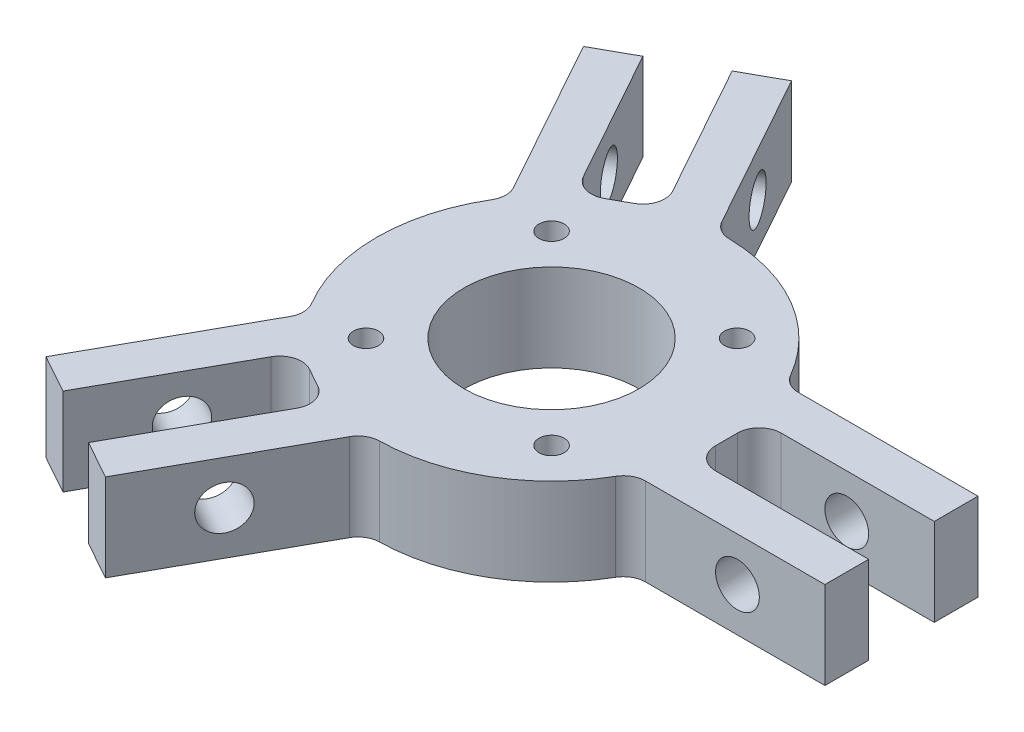
from build123d import *
from OCP.BRepAlgoAPI import BRepAlgoAPI_Cut
from OCP.TopTools import TopTools_ListOfShape

# Parameters (mm, degrees)
SKETCH1_R            = 12.7
SKETCH1_R_2          = 1.8288
BOSS_EXTRUDE1_DEPTH  = 6.35
SKETCH4_W            = 3.175
SKETCH4_H            = 6.35
SKETCH4_AT_POINT_2_W = 3.175
SKETCH4_AT_POINT_2_H = 6.35
SKETCH4_AT_POINT_3_W = 3.175
SKETCH4_AT_POINT_3_H = 6.35
SKETCH4_AT_POINT_4_W = 3.175
SKETCH4_AT_POINT_4_H = 6.35
SKETCH4_AT_POINT_5_W = 3.175
SKETCH4_AT_POINT_5_H = 6.35
SKETCH4_AT_POINT_6_W = 3.175
SKETCH4_AT_POINT_6_H = 6.35
FILLET1_R            = 3.175


with BuildPart() as part:
    # Sketch1 → Boss-Extrude1 (new, symmetric)
    with BuildSketch(Plane(origin=(0, 0, 0), x_dir=(1, 0, 0), z_dir=(0, 1, 0))):
        with BuildLine():
            Line((25.4, 4.7625), (25.4, -4.7625))
            Line((25.4, -4.7625), (50.8, -4.7625))
            Line((50.8, -4.7625), (50.8, -11.1125))
            Line((50.8, -11.1125), (22.84014763, -11.1125))
            ThreePointArc((22.84014763, -11.1125), (12.881044339, -21.891521115), (-1.378083513, -25.362588311))
            Line((-1.378083513, -25.362588311), (-14.956588173, -49.8038967))
            Line((-14.956588173, -49.8038967), (-20.507486876, -46.720064087))
            Line((-20.507486876, -46.720064087), (-8.172156424, -24.516469273))
            Line((-8.172156424, -24.516469273), (-16.498504479, -19.890720354))
            Line((-16.498504479, -19.890720354), (-28.833834931, -42.094315167))
            Line((-28.833834931, -42.094315167), (-34.384733635, -39.010482554))
            Line((-34.384733635, -39.010482554), (-20.806228974, -14.569174166))
            ThreePointArc((-20.806228974, -14.569174166), (-25.4, 0), (-20.806228974, 14.569174166))
            Line((-20.806228974, 14.569174166), (-34.384733635, 39.010482554))
            Line((-34.384733635, 39.010482554), (-28.833834931, 42.094315167))
            Line((-28.833834931, 42.094315167), (-16.498504479, 19.890720354))
            Line((-16.498504479, 19.890720354), (-8.172156424, 24.516469273))
            Line((-8.172156424, 24.516469273), (-20.507486876, 46.720064087))
            Line((-20.507486876, 46.720064087), (-14.956588173, 49.8038967))
            Line((-14.956588173, 49.8038967), (-1.378083513, 25.362588311))
            ThreePointArc((-1.378083513, 25.362588311), (12.881044339, 21.891521115), (22.84014763, 11.1125))
            Line((22.84014763, 11.1125), (50.8, 11.1125))
            Line((50.8, 11.1125), (50.8, 4.7625))
            Line((50.8, 4.7625), (25.4, 4.7625))
        make_face()
        Circle(SKETCH1_R, mode=Mode.SUBTRACT)
        with Locations((-13.470384182, 13.470384182)):
            Circle(SKETCH1_R_2, mode=Mode.SUBTRACT)
        with Locations((13.470384182, 13.470384182)):
            Circle(SKETCH1_R_2, mode=Mode.SUBTRACT)
        with Locations((13.470384182, -13.470384182)):
            Circle(SKETCH1_R_2, mode=Mode.SUBTRACT)
        with Locations((-13.470384182, -13.470384182)):
            Circle(SKETCH1_R_2, mode=Mode.SUBTRACT)
    extrude(amount=BOSS_EXTRUDE1_DEPTH, both=True)


with BuildPart() as f_1_4_0_25_diameter_hole1_tool:
    # Sketch4 → 1/4 (0.25) Diameter Hole1 (revolve)
    with BuildSketch(Plane(origin=(38.1, 0, -4.7625), x_dir=(0, -1, 0), z_dir=(1, 0, 0))):
        with Locations((1.5875, 3.175)):
            Rectangle(SKETCH4_W, SKETCH4_H)
    revolve(axis=Axis((38.1, 0, 1.5875), (0, 0, -1)))


with BuildPart() as part_1:
    add(part.part)

    # 1/4 (0.25) Diameter Hole1: cut by f_1_4_0_25_diameter_hole1_tool, with a tolerance
    f_1_4_0_25_diameter_hole1_stock = TopTools_ListOfShape()
    f_1_4_0_25_diameter_hole1_stock.Append(part_1.part.wrapped)
    f_1_4_0_25_diameter_hole1_tools = TopTools_ListOfShape()
    f_1_4_0_25_diameter_hole1_tools.Append(f_1_4_0_25_diameter_hole1_tool.part.wrapped)
    f_1_4_0_25_diameter_hole1_cut = BRepAlgoAPI_Cut()
    f_1_4_0_25_diameter_hole1_cut.SetArguments(f_1_4_0_25_diameter_hole1_stock)
    f_1_4_0_25_diameter_hole1_cut.SetTools(f_1_4_0_25_diameter_hole1_tools)
    f_1_4_0_25_diameter_hole1_cut.SetFuzzyValue(0.00001)
    f_1_4_0_25_diameter_hole1_cut.Build()
    add(Compound.cast(f_1_4_0_25_diameter_hole1_cut.Shape()).solids(), mode=Mode.REPLACE)


with BuildPart() as f_1_4_0_25_diameter_hole1_at_2_tool:
    # Sketch4 at point 2 (carried to point 2, square into its face) → 1/4 (0.25) Diameter Hole1 at 2 (revolve)
    with BuildSketch(Plane(origin=(-14.33982165, 0, -35.61826668), x_dir=(0, -1, 0), z_dir=(0.485643101, 0, 0.874157182))):
        with Locations((1.5875, 3.175)):
            Rectangle(SKETCH4_AT_POINT_2_W, SKETCH4_AT_POINT_2_H)
    revolve(axis=Axis((-19.890719755, 0, -32.534432989), (0.874157182, 0, -0.485643101)))


with BuildPart() as part_2:
    add(part_1.part)

    # 1/4 (0.25) Diameter Hole1 at 2: cut by f_1_4_0_25_diameter_hole1_at_2_tool, with a tolerance
    f_1_4_0_25_diameter_hole1_at_2_stock = TopTools_ListOfShape()
    f_1_4_0_25_diameter_hole1_at_2_stock.Append(part_2.part.wrapped)
    f_1_4_0_25_diameter_hole1_at_2_tools = TopTools_ListOfShape()
    f_1_4_0_25_diameter_hole1_at_2_tools.Append(f_1_4_0_25_diameter_hole1_at_2_tool.part.wrapped)
    f_1_4_0_25_diameter_hole1_at_2_cut = BRepAlgoAPI_Cut()
    f_1_4_0_25_diameter_hole1_at_2_cut.SetArguments(f_1_4_0_25_diameter_hole1_at_2_stock)
    f_1_4_0_25_diameter_hole1_at_2_cut.SetTools(f_1_4_0_25_diameter_hole1_at_2_tools)
    f_1_4_0_25_diameter_hole1_at_2_cut.SetFuzzyValue(0.00001)
    f_1_4_0_25_diameter_hole1_at_2_cut.Build()
    add(Compound.cast(f_1_4_0_25_diameter_hole1_at_2_cut.Shape()).solids(), mode=Mode.REPLACE)


with BuildPart() as f_1_4_0_25_diameter_hole1_at_3_tool:
    # Sketch4 at point 3 (carried to point 3, square into its face) → 1/4 (0.25) Diameter Hole1 at 3 (revolve)
    with BuildSketch(Plane(origin=(-22.666169705, 0, 30.99251776), x_dir=(0, -1, 0), z_dir=(0.485643101, 0, -0.874157182))):
        with Locations((1.5875, 3.175)):
            Rectangle(SKETCH4_AT_POINT_3_W, SKETCH4_AT_POINT_3_H)
    revolve(axis=Axis((-17.115271601, 0, 34.076351452), (-0.874157182, 0, -0.485643101)))


with BuildPart() as part_3:
    add(part_2.part)

    # 1/4 (0.25) Diameter Hole1 at 3: cut by f_1_4_0_25_diameter_hole1_at_3_tool, with a tolerance
    f_1_4_0_25_diameter_hole1_at_3_stock = TopTools_ListOfShape()
    f_1_4_0_25_diameter_hole1_at_3_stock.Append(part_3.part.wrapped)
    f_1_4_0_25_diameter_hole1_at_3_tools = TopTools_ListOfShape()
    f_1_4_0_25_diameter_hole1_at_3_tools.Append(f_1_4_0_25_diameter_hole1_at_3_tool.part.wrapped)
    f_1_4_0_25_diameter_hole1_at_3_cut = BRepAlgoAPI_Cut()
    f_1_4_0_25_diameter_hole1_at_3_cut.SetArguments(f_1_4_0_25_diameter_hole1_at_3_stock)
    f_1_4_0_25_diameter_hole1_at_3_cut.SetTools(f_1_4_0_25_diameter_hole1_at_3_tools)
    f_1_4_0_25_diameter_hole1_at_3_cut.SetFuzzyValue(0.00001)
    f_1_4_0_25_diameter_hole1_at_3_cut.Build()
    add(Compound.cast(f_1_4_0_25_diameter_hole1_at_3_cut.Shape()).solids(), mode=Mode.REPLACE)


with BuildPart() as f_1_4_0_25_diameter_hole1_at_4_tool:
    # Sketch4 at point 4 (carried to point 4, square into its face) → 1/4 (0.25) Diameter Hole1 at 4 (revolve)
    with BuildSketch(Plane(origin=(-14.33982165, 0, 35.61826668), x_dir=(0, -1, 0), z_dir=(-0.485643101, 0, 0.874157182))):
        with Locations((1.5875, 3.175)):
            Rectangle(SKETCH4_AT_POINT_4_W, SKETCH4_AT_POINT_4_H)
    revolve(axis=Axis((-19.890719755, 0, 32.534432989), (0.874157182, 0, 0.485643101)))


with BuildPart() as part_4:
    add(part_3.part)

    # 1/4 (0.25) Diameter Hole1 at 4: cut by f_1_4_0_25_diameter_hole1_at_4_tool, with a tolerance
    f_1_4_0_25_diameter_hole1_at_4_stock = TopTools_ListOfShape()
    f_1_4_0_25_diameter_hole1_at_4_stock.Append(part_4.part.wrapped)
    f_1_4_0_25_diameter_hole1_at_4_tools = TopTools_ListOfShape()
    f_1_4_0_25_diameter_hole1_at_4_tools.Append(f_1_4_0_25_diameter_hole1_at_4_tool.part.wrapped)
    f_1_4_0_25_diameter_hole1_at_4_cut = BRepAlgoAPI_Cut()
    f_1_4_0_25_diameter_hole1_at_4_cut.SetArguments(f_1_4_0_25_diameter_hole1_at_4_stock)
    f_1_4_0_25_diameter_hole1_at_4_cut.SetTools(f_1_4_0_25_diameter_hole1_at_4_tools)
    f_1_4_0_25_diameter_hole1_at_4_cut.SetFuzzyValue(0.00001)
    f_1_4_0_25_diameter_hole1_at_4_cut.Build()
    add(Compound.cast(f_1_4_0_25_diameter_hole1_at_4_cut.Shape()).solids(), mode=Mode.REPLACE)


with BuildPart() as f_1_4_0_25_diameter_hole1_at_5_tool:
    # Sketch4 at point 5 (carried to point 5, square into its face) → 1/4 (0.25) Diameter Hole1 at 5 (revolve)
    with BuildSketch(Plane(origin=(-22.666169705, 0, -30.99251776), x_dir=(0, -1, 0), z_dir=(-0.485643101, 0, -0.874157182))):
        with Locations((1.5875, 3.175)):
            Rectangle(SKETCH4_AT_POINT_5_W, SKETCH4_AT_POINT_5_H)
    revolve(axis=Axis((-17.115271601, 0, -34.076351452), (-0.874157182, 0, 0.485643101)))


with BuildPart() as part_5:
    add(part_4.part)

    # 1/4 (0.25) Diameter Hole1 at 5: cut by f_1_4_0_25_diameter_hole1_at_5_tool, with a tolerance
    f_1_4_0_25_diameter_hole1_at_5_stock = TopTools_ListOfShape()
    f_1_4_0_25_diameter_hole1_at_5_stock.Append(part_5.part.wrapped)
    f_1_4_0_25_diameter_hole1_at_5_tools = TopTools_ListOfShape()
    f_1_4_0_25_diameter_hole1_at_5_tools.Append(f_1_4_0_25_diameter_hole1_at_5_tool.part.wrapped)
    f_1_4_0_25_diameter_hole1_at_5_cut = BRepAlgoAPI_Cut()
    f_1_4_0_25_diameter_hole1_at_5_cut.SetArguments(f_1_4_0_25_diameter_hole1_at_5_stock)
    f_1_4_0_25_diameter_hole1_at_5_cut.SetTools(f_1_4_0_25_diameter_hole1_at_5_tools)
    f_1_4_0_25_diameter_hole1_at_5_cut.SetFuzzyValue(0.00001)
    f_1_4_0_25_diameter_hole1_at_5_cut.Build()
    add(Compound.cast(f_1_4_0_25_diameter_hole1_at_5_cut.Shape()).solids(), mode=Mode.REPLACE)


with BuildPart() as f_1_4_0_25_diameter_hole1_at_6_tool:
    # Sketch4 at point 6 (carried to point 6, square into its face) → 1/4 (0.25) Diameter Hole1 at 6 (revolve)
    with BuildSketch(Plane(origin=(38.1, 0, 4.7625), x_dir=(0, -1, 0), z_dir=(-1, 0, 0))):
        with Locations((1.5875, 3.175)):
            Rectangle(SKETCH4_AT_POINT_6_W, SKETCH4_AT_POINT_6_H)
    revolve(axis=Axis((38.1, 0, -1.5875), (0, 0, 1)))


with BuildPart() as part_6:
    add(part_5.part)

    # 1/4 (0.25) Diameter Hole1 at 6: cut by f_1_4_0_25_diameter_hole1_at_6_tool, with a tolerance
    f_1_4_0_25_diameter_hole1_at_6_stock = TopTools_ListOfShape()
    f_1_4_0_25_diameter_hole1_at_6_stock.Append(part_6.part.wrapped)
    f_1_4_0_25_diameter_hole1_at_6_tools = TopTools_ListOfShape()
    f_1_4_0_25_diameter_hole1_at_6_tools.Append(f_1_4_0_25_diameter_hole1_at_6_tool.part.wrapped)
    f_1_4_0_25_diameter_hole1_at_6_cut = BRepAlgoAPI_Cut()
    f_1_4_0_25_diameter_hole1_at_6_cut.SetArguments(f_1_4_0_25_diameter_hole1_at_6_stock)
    f_1_4_0_25_diameter_hole1_at_6_cut.SetTools(f_1_4_0_25_diameter_hole1_at_6_tools)
    f_1_4_0_25_diameter_hole1_at_6_cut.SetFuzzyValue(0.00001)
    f_1_4_0_25_diameter_hole1_at_6_cut.Build()
    add(Compound.cast(f_1_4_0_25_diameter_hole1_at_6_cut.Shape()).solids(), mode=Mode.REPLACE)

    # Fillet1
    fillet1_edges = [part_6.edges().sort_by_distance(p)[0] for p in [
        (-20.806228974, 0, 14.569174166),
        (-16.498504479, 0, 19.890720354),
        (-8.172156424, 0, 24.516469273),
        (-1.378083513, 0, 25.362588311),
        (22.84014763, 0, 11.1125),
        (25.4, 0, -4.7625),
        (22.84014763, 0, -11.1125),
        (-1.378083513, 0, -25.362588311),
        (-8.172156424, 0, -24.516469273),
        (-16.498504479, 0, -19.890720354),
        (-20.806228974, 0, -14.569174166),
        (25.4, 0, 4.7625),
    ]]
    fillet(fillet1_edges, radius=FILLET1_R)


solid = part_6.part
